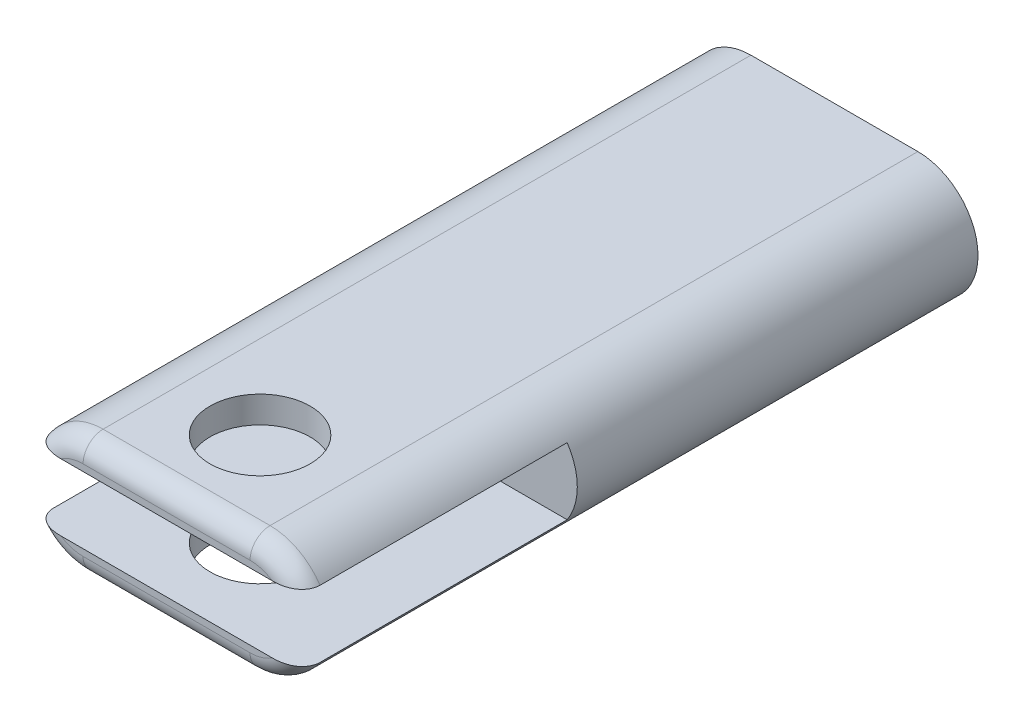
from build123d import *

# Parameters (mm, degrees)
BOSS_EXTRUDE1_DEPTH = 1000
FILLET1_R           = 30
SKETCH2_W           = 431.388380784
SKETCH2_H           = 100
CUT_EXTRUDE1_DEPTH  = 400
SKETCH3_R           = 75
CUT_EXTRUDE2_DEPTH  = 1039.568726775


with BuildPart() as part:
    # Sketch1 → Boss-Extrude1 (new body)
    with BuildSketch(Plane.XY):
        with BuildLine():
            Line((-125, 90), (125, 90))
            ThreePointArc((125, 90), (215, 0), (125, -90))
            Line((125, -90), (-125, -90))
            ThreePointArc((-125, -90), (-215, 0), (-125, 90))
        make_face()
    extrude(amount=BOSS_EXTRUDE1_DEPTH)

    # Fillet1
    fillet1_edges = [part.edges().sort_by_distance(p)[0] for p in [
        (-215, 0, 1000),
        (215, 0, 1000),
        (0, 90, 1000),
        (0, -90, 1000),
    ]]
    fillet(fillet1_edges, radius=FILLET1_R)

    # Sketch2 → Cut-Extrude1 (cut)
    with BuildSketch(Plane.XY.offset(1000)):
        with Locations((-0.091183766, 0)):
            Rectangle(SKETCH2_W, SKETCH2_H)
    extrude(amount=-CUT_EXTRUDE1_DEPTH, mode=Mode.SUBTRACT)

    # Sketch3 → Cut-Extrude2 (cut, through all)
    with BuildSketch(Plane(origin=(0, 90, 0), x_dir=(1, 0, 0), z_dir=(0, 1, 0))):
        with Locations((0, -860)):
            Circle(SKETCH3_R)
    extrude(amount=-CUT_EXTRUDE2_DEPTH, mode=Mode.SUBTRACT)


solid = part.part
